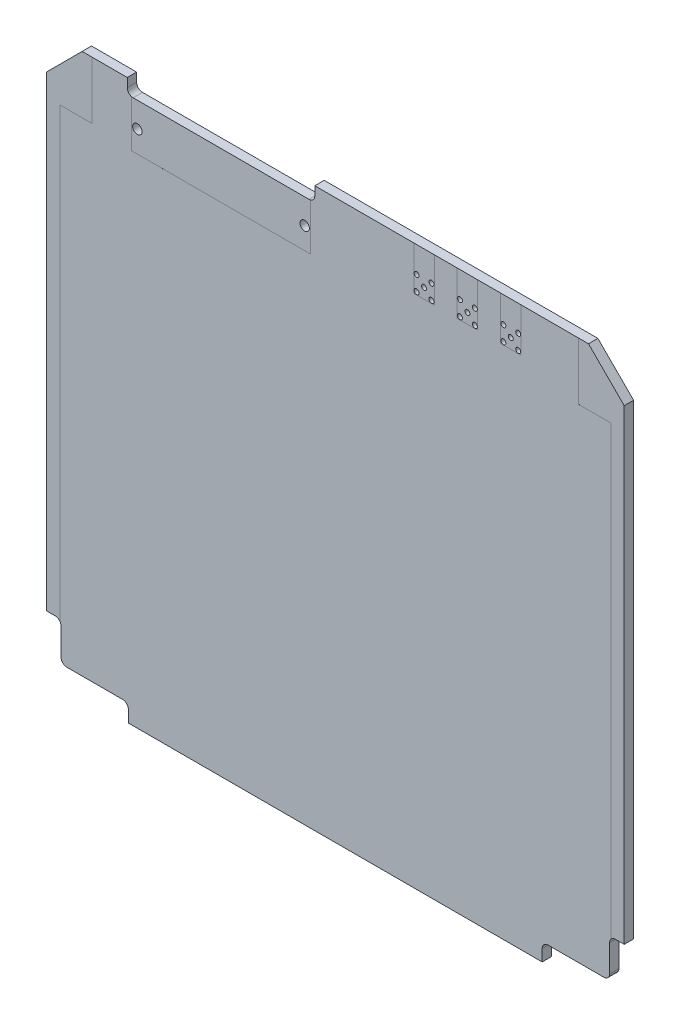
from build123d import *

# Parameters (mm, degrees)
SKETCH1_R           = 0.425
SKETCH1_R_2         = 0.8
BOSS_EXTRUDE1_DEPTH = 1.6
CUT_EXTRUDE2_DEPTH  = 0.0001
PARTFOOTPRINTS_W    = 30.48
PARTFOOTPRINTS_H    = 7.989227112
PARTFOOTPRINTS_W_2  = 3.5
PARTFOOTPRINTS_H_2  = 7.45
CUT_EXTRUDE3_DEPTH  = 0.0001


with BuildPart() as part:
    # Sketch1 → Boss-Extrude1 (new body)
    with BuildSketch(Plane(origin=(0, 0, -0.0125), x_dir=(-1, 0, 0), z_dir=(0, 0, -1))):
        with BuildLine():
            Line((35.3, -50), (35.3, -48))
            ThreePointArc((35.3, -48), (35.592893219, -47.292893219), (36.3, -47))
            Line((36.3, -47), (45.8, -47))
            ThreePointArc((45.8, -47), (46.507106781, -46.707106781), (46.8, -46))
            Line((46.8, -46), (46.8, -41.4))
            ThreePointArc((46.8, -41.4), (47.092893219, -40.692893219), (47.8, -40.4))
            Line((47.8, -40.4), (49.3, -40.4))
            Line((49.3, -40.4), (49.3, 39.2))
            Line((49.3, 39.2), (43.2, 45.3))
            Line((43.2, 45.3), (35.500000002, 45.3))
            Line((35.500000002, 45.3), (35.500000002, 43.8))
            ThreePointArc((35.500000002, 43.8), (35.207106783, 43.092893219), (34.500000002, 42.8))
            Line((34.500000002, 42.8), (4.499999998, 42.8))
            ThreePointArc((4.499999998, 42.8), (3.792893217, 43.092893219), (3.499999998, 43.8))
            Line((3.499999998, 43.8), (3.499999998, 45.3))
            Line((3.499999998, 45.3), (-43.2, 45.3))
            Line((-43.2, 45.3), (-49.3, 39.2))
            Line((-49.3, 39.2), (-49.3, -40.4))
            Line((-49.3, -40.4), (-47.8, -40.4))
            ThreePointArc((-47.8, -40.4), (-47.092893219, -40.692893219), (-46.8, -41.4))
            Line((-46.8, -41.4), (-46.8, -46))
            ThreePointArc((-46.8, -46), (-46.507106781, -46.707106781), (-45.8, -47))
            Line((-45.8, -47), (-36.3, -47))
            ThreePointArc((-36.3, -47), (-35.592893219, -47.292893219), (-35.3, -48))
            Line((-35.3, -48), (-35.3, -50))
            Line((-35.3, -50), (35.3, -50))
        make_face()
        with Locations((-21.27, 40.87)):
            Circle(SKETCH1_R, mode=Mode.SUBTRACT)
        with Locations((-23.81, 40.87)):
            Circle(SKETCH1_R, mode=Mode.SUBTRACT)
        with Locations((-22.54, 39.6)):
            Circle(SKETCH1_R, mode=Mode.SUBTRACT)
        with Locations((-13.87, 40.87)):
            Circle(SKETCH1_R, mode=Mode.SUBTRACT)
        with Locations((-23.81, 38.33)):
            Circle(SKETCH1_R, mode=Mode.SUBTRACT)
        with Locations((-16.41, 40.87)):
            Circle(SKETCH1_R, mode=Mode.SUBTRACT)
        with Locations((-15.14, 39.6)):
            Circle(SKETCH1_R, mode=Mode.SUBTRACT)
        with Locations((-21.27, 38.33)):
            Circle(SKETCH1_R, mode=Mode.SUBTRACT)
        with Locations((-28.67, 40.87)):
            Circle(SKETCH1_R, mode=Mode.SUBTRACT)
        with Locations((-31.21, 40.87)):
            Circle(SKETCH1_R, mode=Mode.SUBTRACT)
        with Locations((-16.41, 38.33)):
            Circle(SKETCH1_R, mode=Mode.SUBTRACT)
        with Locations((-29.94, 39.6)):
            Circle(SKETCH1_R, mode=Mode.SUBTRACT)
        with Locations((-31.21, 38.33)):
            Circle(SKETCH1_R, mode=Mode.SUBTRACT)
        with Locations((-28.67, 38.33)):
            Circle(SKETCH1_R, mode=Mode.SUBTRACT)
        with Locations((33.775, 38.54)):
            Circle(SKETCH1_R_2, mode=Mode.SUBTRACT)
        with Locations((5.225, 38.54)):
            Circle(SKETCH1_R_2, mode=Mode.SUBTRACT)
        with Locations((-13.87, 38.33)):
            Circle(SKETCH1_R, mode=Mode.SUBTRACT)
    extrude(amount=-BOSS_EXTRUDE1_DEPTH)

    # thermalContacts_upper → Cut-Extrude2 (cut)
    with BuildSketch(Plane.XY.offset(1.5875)):
        Polygon((-47, 35.5), (-47, -41.5), (-56.192158269, -41.5), (-56.192158269, 47), (-41.5, 47), (-41.5, 41.5), (-41.5, 35.5), align=None)
        Polygon((47, 35.5), (47, -41.5), (59.827263463, -41.5), (59.827263463, 47), (41.5, 47), (41.5, 41.5), (41.5, 35.5), align=None)
    extrude(amount=-CUT_EXTRUDE2_DEPTH, mode=Mode.SUBTRACT)

    # partFootprints → Cut-Extrude3 (cut)
    with BuildSketch(Plane.XY.offset(1.5875)):
        with Locations((-19.5, 38.834613556)):
            Rectangle(PARTFOOTPRINTS_W, PARTFOOTPRINTS_H)
        with Locations((15.14, 41.575)):
            Rectangle(PARTFOOTPRINTS_W_2, PARTFOOTPRINTS_H_2)
        with Locations((22.54, 41.575)):
            Rectangle(PARTFOOTPRINTS_W_2, PARTFOOTPRINTS_H_2)
        with Locations((29.94, 41.575)):
            Rectangle(PARTFOOTPRINTS_W_2, PARTFOOTPRINTS_H_2)
    extrude(amount=-CUT_EXTRUDE3_DEPTH, mode=Mode.SUBTRACT)


solid = part.part
